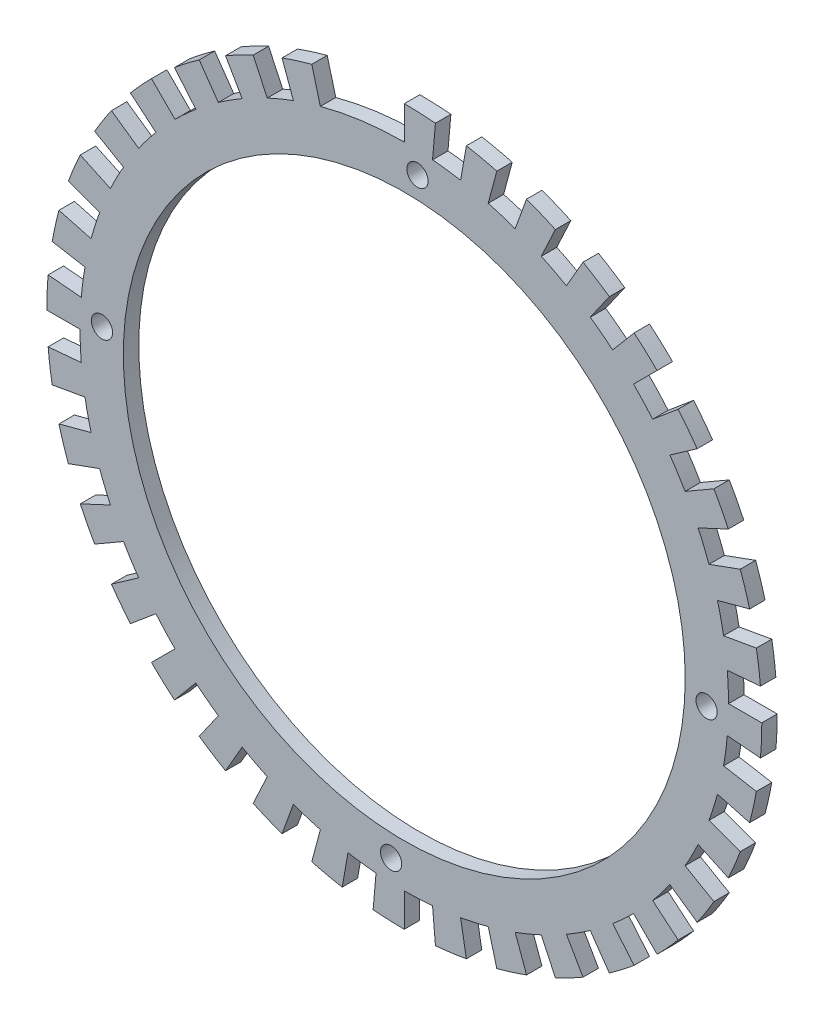
from build123d import *

# Parameters (mm, degrees)
SKETCH1_R           = 64.990473148
SKETCH1_R_2         = 2.4585
BOSS_EXTRUDE1_DEPTH = 3.571875


with BuildPart() as part:
    # Sketch1 → Boss-Extrude1 (new body)
    with BuildSketch(Plane.XY):
        with BuildLine():
            Line((0, 82.7), (0, 75))
            Line((0, 75), (-0.312893498, 74.999347315))
            ThreePointArc((-0.312893498, 74.999347315), (-6.692518262, 74.700804543), (-13.023613356, 73.86058147))
            ThreePointArc((-13.023613356, 73.86058147), (-16.232971075, 73.222200527), (-19.41142841, 72.444436964))
            Line((-19.41142841, 72.444436964), (-21.404335061, 79.882065826))
            ThreePointArc((-21.404335061, 79.882065826), (-24.868369649, 78.872391817), (-28.285065883, 77.712579728))
            Line((-28.285065883, 77.712579728), (-25.651510779, 70.476946548))
            ThreePointArc((-25.651510779, 70.476946548), (-28.701257455, 69.290964927), (-31.696369656, 67.973084016))
            Line((-31.696369656, 67.973084016), (-34.950530274, 74.951653975))
            ThreePointArc((-34.950530274, 74.951653975), (-38.186610342, 73.35579589), (-41.350000027, 71.620300878))
            Line((-41.350000027, 71.620300878), (-37.500000026, 64.951905269))
            ThreePointArc((-37.500000026, 64.951905269), (-40.29747065, 63.254358421), (-43.018232748, 61.436403306))
            Line((-43.018232748, 61.436403306), (-47.434771311, 67.743874046))
            ThreePointArc((-47.434771311, 67.743874046), (-50.344570203, 65.610321224), (-53.158535344, 63.351875427))
            Line((-53.158535344, 63.351875427), (-48.209070749, 57.453333215))
            ThreePointArc((-48.209070749, 57.453333215), (-50.669265592, 55.295800242), (-53.033008607, 53.03300857))
            Line((-53.033008607, 53.03300857), (-58.477730825, 58.477730784))
            ThreePointArc((-58.477730825, 58.477730784), (-60.972835774, 55.871310149), (-63.351875464, 53.158535299))
            Line((-63.351875464, 53.158535299), (-57.453333252, 48.209070705))
            ThreePointArc((-57.453333252, 48.209070705), (-59.501500538, 45.657107154), (-61.436403336, 43.018232706))
            Line((-61.436403336, 43.018232706), (-67.743874079, 47.434771263))
            ThreePointArc((-67.743874079, 47.434771263), (-69.748472584, 44.434677587), (-71.620300907, 41.349999976))
            Line((-71.620300907, 41.349999976), (-64.951905298, 37.499999976))
            ThreePointArc((-64.951905298, 37.499999976), (-66.5258125, 34.63114597), (-67.973084038, 31.696369608))
            Line((-67.973084038, 31.696369608), (-74.951653999, 34.950530222))
            ThreePointArc((-74.951653999, 34.950530222), (-76.404837349, 31.647919832), (-77.712579748, 28.285065828))
            Line((-77.712579748, 28.285065828), (-70.476946568, 25.651510724))
            ThreePointArc((-70.476946568, 25.651510724), (-71.528771314, 22.552934939), (-72.444436978, 19.41142836))
            Line((-72.444436978, 19.41142836), (-79.882065841, 21.404335005))
            ThreePointArc((-79.882065841, 21.404335005), (-80.739679794, 17.899556047), (-81.443601179, 14.360704267))
            Line((-81.443601179, 14.360704267), (-73.86058148, 13.023613299))
            ThreePointArc((-73.86058148, 13.023613299), (-74.358364606, 9.789464392), (-74.714602359, 6.536680683))
            Line((-74.714602359, 6.536680683), (-82.385301534, 7.2077799))
            ThreePointArc((-82.385301534, 7.2077799), (-82.621287926, 3.60732331), (-82.7, -2.5e-08))
            Line((-82.7, -2.5e-08), (-75, -2.5e-08))
            ThreePointArc((-75, -2.5e-08), (-74.928616618, -3.271454076), (-74.714602355, -6.536680728))
            Line((-74.714602355, -6.536680728), (-82.38530153, -7.207779949))
            ThreePointArc((-82.38530153, -7.207779949), (-81.992490032, -10.794516121), (-81.44360117, -14.360704317))
            Line((-81.44360117, -14.360704317), (-73.860581472, -13.023613349))
            ThreePointArc((-73.860581472, -13.023613349), (-73.222200529, -16.232971068), (-72.444436966, -19.411428403))
            Line((-72.444436966, -19.411428403), (-79.882065828, -21.404335052))
            ThreePointArc((-79.882065828, -21.404335052), (-78.87239182, -24.868369641), (-77.712579731, -28.285065875))
            Line((-77.712579731, -28.285065875), (-70.476946551, -25.651510771))
            ThreePointArc((-70.476946551, -25.651510771), (-69.29096493, -28.701257448), (-67.973084019, -31.696369649))
            Line((-67.973084019, -31.696369649), (-74.951653978, -34.950530266))
            ThreePointArc((-74.951653978, -34.950530266), (-73.355795894, -38.186610334), (-71.620300882, -41.350000019))
            Line((-71.620300882, -41.350000019), (-64.951905273, -37.50000002))
            ThreePointArc((-64.951905273, -37.50000002), (-63.254358425, -40.297470644), (-61.436403311, -43.018232742))
            Line((-61.436403311, -43.018232742), (-67.74387405, -47.434771304))
            ThreePointArc((-67.74387405, -47.434771304), (-65.610321229, -50.344570196), (-63.351875432, -53.158535337))
            Line((-63.351875432, -53.158535337), (-57.45333322, -48.209070743))
            ThreePointArc((-57.45333322, -48.209070743), (-55.295800247, -50.669265586), (-53.033008576, -53.033008602))
            Line((-53.033008576, -53.033008602), (-58.47773079, -58.477730819))
            ThreePointArc((-58.47773079, -58.477730819), (-55.871310155, -60.972835768), (-53.158535305, -63.351875459))
            Line((-53.158535305, -63.351875459), (-48.20907071, -57.453333247))
            ThreePointArc((-48.20907071, -57.453333247), (-45.65710716, -59.501500534), (-43.018232712, -61.436403332))
            Line((-43.018232712, -61.436403332), (-47.43477127, -67.743874074))
            ThreePointArc((-47.43477127, -67.743874074), (-44.434677594, -69.748472579), (-41.349999983, -71.620300903))
            Line((-41.349999983, -71.620300903), (-37.499999983, -64.951905294))
            ThreePointArc((-37.499999983, -64.951905294), (-34.631145976, -66.525812497), (-31.696369615, -67.973084035))
            Line((-31.696369615, -67.973084035), (-34.950530229, -74.951653996))
            ThreePointArc((-34.950530229, -74.951653996), (-31.647919839, -76.404837346), (-28.285065836, -77.712579745))
            Line((-28.285065836, -77.712579745), (-25.651510731, -70.476946566))
            ThreePointArc((-25.651510731, -70.476946566), (-22.552934946, -71.528771311), (-19.411428367, -72.444436976))
            Line((-19.411428367, -72.444436976), (-21.404335013, -79.882065839))
            ThreePointArc((-21.404335013, -79.882065839), (-17.899556055, -80.739679793), (-14.360704276, -81.443601177))
            Line((-14.360704276, -81.443601177), (-13.023613307, -73.860581479))
            ThreePointArc((-13.023613307, -73.860581479), (-9.7894644, -74.358364605), (-6.536680691, -74.714602358))
            Line((-6.536680691, -74.714602358), (-7.207779909, -82.385301534))
            ThreePointArc((-7.207779909, -82.385301534), (-3.607323318, -82.621287926), (1.7e-08, -82.7))
            Line((1.7e-08, -82.7), (1.8e-08, -75))
            ThreePointArc((1.8e-08, -75), (3.271454068, -74.928616618), (6.53668072, -74.714602356))
            Line((6.53668072, -74.714602356), (7.207779941, -82.385301531))
            ThreePointArc((7.207779941, -82.385301531), (10.794516112, -81.992490034), (14.360704309, -81.443601171))
            Line((14.360704309, -81.443601171), (13.023613341, -73.860581473))
            ThreePointArc((13.023613341, -73.860581473), (16.23297106, -73.222200531), (19.411428396, -72.444436968))
            Line((19.411428396, -72.444436968), (21.404335044, -79.88206583))
            ThreePointArc((21.404335044, -79.88206583), (24.868369633, -78.872391822), (28.285065867, -77.712579734))
            Line((28.285065867, -77.712579734), (25.651510764, -70.476946554))
            ThreePointArc((25.651510764, -70.476946554), (28.701257441, -69.290964933), (31.696369642, -67.973084022))
            Line((31.696369642, -67.973084022), (34.950530259, -74.951653982))
            ThreePointArc((34.950530259, -74.951653982), (38.186610327, -73.355795897), (41.350000012, -71.620300886))
            Line((41.350000012, -71.620300886), (37.500000013, -64.951905276))
            ThreePointArc((37.500000013, -64.951905276), (40.297470637, -63.254358429), (43.018232736, -61.436403315))
            Line((43.018232736, -61.436403315), (47.434771297, -67.743874055))
            ThreePointArc((47.434771297, -67.743874055), (50.344570189, -65.610321234), (53.158535331, -63.351875438))
            Line((53.158535331, -63.351875438), (48.209070737, -57.453333225))
            ThreePointArc((48.209070737, -57.453333225), (50.66926558, -55.295800252), (53.033008597, -53.033008581))
            Line((53.033008597, -53.033008581), (58.477730813, -58.477730796))
            ThreePointArc((58.477730813, -58.477730796), (60.972835762, -55.871310161), (63.351875454, -53.158535312))
            Line((63.351875454, -53.158535312), (57.453333242, -48.209070716))
            ThreePointArc((57.453333242, -48.209070716), (59.501500529, -45.657107166), (61.436403327, -43.018232718))
            Line((61.436403327, -43.018232718), (67.743874069, -47.434771277))
            ThreePointArc((67.743874069, -47.434771277), (69.748472575, -44.434677601), (71.620300899, -41.34999999))
            Line((71.620300899, -41.34999999), (64.95190529, -37.499999989))
            ThreePointArc((64.95190529, -37.499999989), (66.525812493, -34.631145983), (67.973084032, -31.696369622))
            Line((67.973084032, -31.696369622), (74.951653992, -34.950530237))
            ThreePointArc((74.951653992, -34.950530237), (76.404837343, -31.647919847), (77.712579742, -28.285065843))
            Line((77.712579742, -28.285065843), (70.476946563, -25.651510739))
            ThreePointArc((70.476946563, -25.651510739), (71.528771309, -22.552934953), (72.444436974, -19.411428375))
            Line((72.444436974, -19.411428375), (79.882065837, -21.404335021))
            ThreePointArc((79.882065837, -21.404335021), (80.739679791, -17.899556064), (81.443601176, -14.360704284))
            Line((81.443601176, -14.360704284), (73.860581478, -13.023613314))
            ThreePointArc((73.860581478, -13.023613314), (74.358364604, -9.789464407), (74.714602358, -6.536680699))
            Line((74.714602358, -6.536680699), (82.385301533, -7.207779917))
            ThreePointArc((82.385301533, -7.207779917), (82.621287925, -3.607323327), (82.7, 8e-09))
            Line((82.7, 8e-09), (75, 1e-08))
            ThreePointArc((75, 1e-08), (74.928616618, 3.271454061), (74.714602356, 6.536680713))
            Line((74.714602356, 6.536680713), (82.385301532, 7.207779933))
            ThreePointArc((82.385301532, 7.207779933), (81.992490035, 10.794516104), (81.443601173, 14.3607043))
            Line((81.443601173, 14.3607043), (73.860581474, 13.023613334))
            ThreePointArc((73.860581474, 13.023613334), (73.222200532, 16.232971053), (72.44443697, 19.411428388))
            Line((72.44443697, 19.411428388), (79.882065832, 21.404335036))
            ThreePointArc((79.882065832, 21.404335036), (78.872391825, 24.868369625), (77.712579737, 28.285065859))
            Line((77.712579737, 28.285065859), (70.476946556, 25.651510757))
            ThreePointArc((70.476946556, 25.651510757), (69.290964936, 28.701257434), (67.973084026, 31.696369635))
            Line((67.973084026, 31.696369635), (74.951653986, 34.950530251))
            ThreePointArc((74.951653986, 34.950530251), (73.355795901, 38.186610319), (71.62030089, 41.350000005))
            Line((71.62030089, 41.350000005), (64.95190528, 37.500000006))
            ThreePointArc((64.95190528, 37.500000006), (63.254358433, 40.297470631), (61.436403319, 43.01823273))
            Line((61.436403319, 43.01823273), (67.74387406, 47.43477129))
            ThreePointArc((67.74387406, 47.43477129), (65.610321239, 50.344570183), (63.351875443, 53.158535325))
            Line((63.351875443, 53.158535325), (57.45333323, 48.209070732))
            ThreePointArc((57.45333323, 48.209070732), (55.295800257, 50.669265575), (53.033008587, 53.033008591))
            Line((53.033008587, 53.033008591), (58.477730801, 58.477730807))
            ThreePointArc((58.477730801, 58.477730807), (55.871310167, 60.972835757), (53.158535318, 63.351875448))
            Line((53.158535318, 63.351875448), (48.209070722, 57.453333238))
            ThreePointArc((48.209070722, 57.453333238), (45.657107172, 59.501500524), (43.018232724, 61.436403323))
            Line((43.018232724, 61.436403323), (47.434771284, 67.743874064))
            ThreePointArc((47.434771284, 67.743874064), (44.434677608, 69.74847257), (41.349999998, 71.620300894))
            Line((41.349999998, 71.620300894), (37.499999996, 64.951905286))
            ThreePointArc((37.499999996, 64.951905286), (34.63114599, 66.52581249), (31.696369629, 67.973084028))
            Line((31.696369629, 67.973084028), (34.950530244, 74.951653989))
            ThreePointArc((34.950530244, 74.951653989), (31.647919855, 76.404837339), (28.285065851, 77.71257974))
            Line((28.285065851, 77.71257974), (25.651510746, 70.47694656))
            ThreePointArc((25.651510746, 70.47694656), (22.55293496, 71.528771307), (19.411428382, 72.444436972))
            Line((19.411428382, 72.444436972), (21.404335029, 79.882065834))
            ThreePointArc((21.404335029, 79.882065834), (17.899556072, 80.739679789), (14.360704292, 81.443601174))
            Line((14.360704292, 81.443601174), (13.023613322, 73.860581476))
            ThreePointArc((13.023613322, 73.860581476), (9.789464415, 74.358364603), (6.536680706, 74.714602357))
            Line((6.536680706, 74.714602357), (7.207779925, 82.385301532))
            ThreePointArc((7.207779925, 82.385301532), (3.607323335, 82.621287925), (0, 82.7))
        make_face()
        Circle(SKETCH1_R, mode=Mode.SUBTRACT)
        with Locations((3.053149338, 69.928616619)):
            Circle(SKETCH1_R_2, mode=Mode.SUBTRACT)
        with Locations((69.928616619, -3.053149338)):
            Circle(SKETCH1_R_2, mode=Mode.SUBTRACT)
        with Locations((-3.053149338, -69.928616619)):
            Circle(SKETCH1_R_2, mode=Mode.SUBTRACT)
        with Locations((-69.928616619, 3.053149338)):
            Circle(SKETCH1_R_2, mode=Mode.SUBTRACT)
    extrude(amount=BOSS_EXTRUDE1_DEPTH)


solid = part.part
